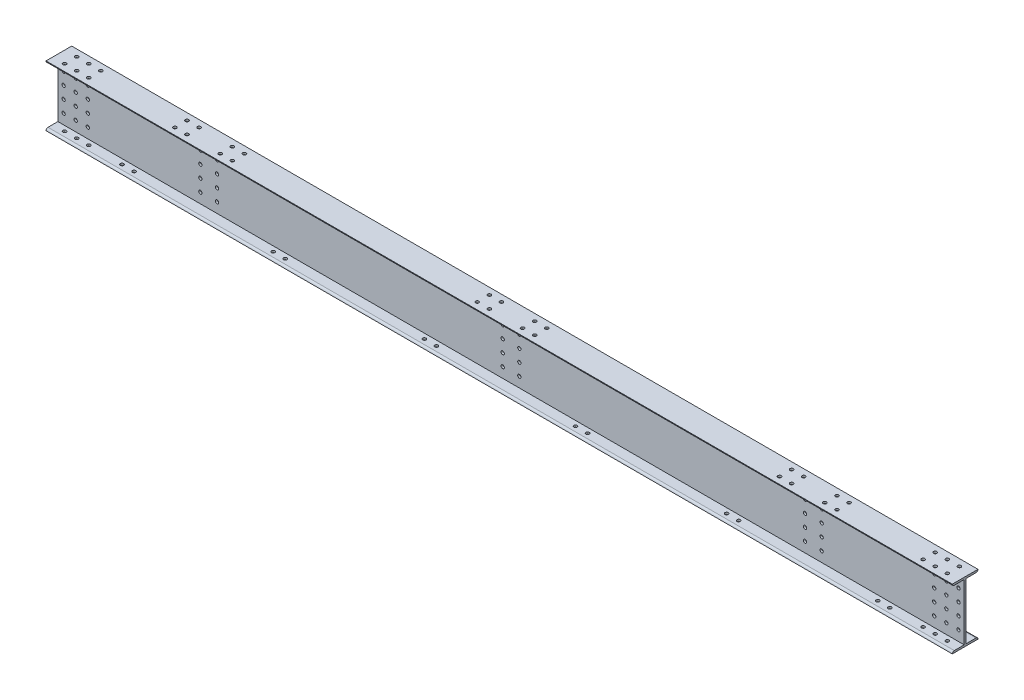
from build123d import *

# Parameters (mm, degrees)
SKETCH_1_W                         = 5996
SKETCH_1_H                         = 400
EXTRUDE_1_DEPTH                    = 170
SKETCH_2_R                         = 11
CUT_EXTRUDE_2_DEPTH                = 6012.731530932
PATTERN_LINEAR_4_COUNT             = 4
PATTERN_LINEAR_4_PITCH             = 80
PATTERN_LINEAR_5_COUNT             = 2
PATTERN_LINEAR_5_PITCH             = 80
PATTERN_LINEAR_5_COPY_1_SKETCH_R   = 11
PATTERN_LINEAR_5_COPY_1_DEPTH      = 6012.731530932
PATTERN_LINEAR_5_COPY_2_SKETCH_R   = 11
PATTERN_LINEAR_5_COPY_2_DEPTH      = 6012.731530932
PATTERN_LINEAR_5_COPY_3_SKETCH_R   = 11
PATTERN_LINEAR_5_COPY_3_DEPTH      = 6012.731530932
PATTERN_LINEAR_6_COUNT             = 2
PATTERN_LINEAR_6_PITCH             = 160
PATTERN_LINEAR_6_COPY_1_SKETCH_R   = 11
PATTERN_LINEAR_6_COPY_1_DEPTH      = 6012.731530932
PATTERN_LINEAR_6_COPY_2_SKETCH_R   = 11
PATTERN_LINEAR_6_COPY_2_DEPTH      = 6012.731530932
PATTERN_LINEAR_6_COPY_3_SKETCH_R   = 11
PATTERN_LINEAR_6_COPY_3_DEPTH      = 6012.731530932
PATTERN_LINEAR_7_COUNT             = 2
PATTERN_LINEAR_7_PITCH             = 905
PATTERN_LINEAR_7_COPY_1_SKETCH_R   = 11
PATTERN_LINEAR_7_COPY_1_DEPTH      = 6012.731530932
PATTERN_LINEAR_7_COPY_2_SKETCH_R   = 11
PATTERN_LINEAR_7_COPY_2_DEPTH      = 6012.731530932
PATTERN_LINEAR_7_COPY_3_SKETCH_R   = 11
PATTERN_LINEAR_7_COPY_3_DEPTH      = 6012.731530932
PATTERN_LINEAR_8_COUNT             = 2
PATTERN_LINEAR_8_PITCH             = 2905
PATTERN_LINEAR_8_COPY_1_SKETCH_R   = 11
PATTERN_LINEAR_8_COPY_1_DEPTH      = 6012.731530932
PATTERN_LINEAR_8_COPY_2_SKETCH_R   = 11
PATTERN_LINEAR_8_COPY_2_DEPTH      = 6012.731530932
PATTERN_LINEAR_8_COPY_3_SKETCH_R   = 11
PATTERN_LINEAR_8_COPY_3_DEPTH      = 6012.731530932
PATTERN_LINEAR_9_COUNT             = 2
PATTERN_LINEAR_9_PITCH             = 4905
PATTERN_LINEAR_9_COPY_1_SKETCH_R   = 11
PATTERN_LINEAR_9_COPY_1_DEPTH      = 6012.731530932
PATTERN_LINEAR_9_COPY_2_SKETCH_R   = 11
PATTERN_LINEAR_9_COPY_2_DEPTH      = 6012.731530932
PATTERN_LINEAR_9_COPY_3_SKETCH_R   = 11
PATTERN_LINEAR_9_COPY_3_DEPTH      = 6012.731530932
PATTERN_LINEAR_10_COUNT            = 2
PATTERN_LINEAR_10_PITCH            = 5760
PATTERN_LINEAR_10_COPY_1_SKETCH_R  = 11
PATTERN_LINEAR_10_COPY_1_DEPTH     = 6012.731530932
PATTERN_LINEAR_10_COPY_2_SKETCH_R  = 11
PATTERN_LINEAR_10_COPY_2_DEPTH     = 6012.731530932
PATTERN_LINEAR_10_COPY_3_SKETCH_R  = 11
PATTERN_LINEAR_10_COPY_3_DEPTH     = 6012.731530932
PATTERN_LINEAR_10_COPY_4_SKETCH_R  = 11
PATTERN_LINEAR_10_COPY_4_DEPTH     = 6012.731530932
PATTERN_LINEAR_10_COPY_5_SKETCH_R  = 11
PATTERN_LINEAR_10_COPY_5_DEPTH     = 6012.731530932
PATTERN_LINEAR_10_COPY_6_SKETCH_R  = 11
PATTERN_LINEAR_10_COPY_6_DEPTH     = 6012.731530932
PATTERN_LINEAR_10_COPY_7_SKETCH_R  = 11
PATTERN_LINEAR_10_COPY_7_DEPTH     = 6012.731530932
PATTERN_LINEAR_10_COPY_8_SKETCH_R  = 11
PATTERN_LINEAR_10_COPY_8_DEPTH     = 6012.731530932
PATTERN_LINEAR_10_COPY_9_SKETCH_R  = 11
PATTERN_LINEAR_10_COPY_9_DEPTH     = 6012.731530932
PATTERN_LINEAR_10_COPY_10_SKETCH_R = 11
PATTERN_LINEAR_10_COPY_10_DEPTH    = 6012.731530932
PATTERN_LINEAR_10_COPY_11_SKETCH_R = 11
PATTERN_LINEAR_10_COPY_11_DEPTH    = 6012.731530932
PATTERN_LINEAR_37_COUNT            = 2
PATTERN_LINEAR_37_PITCH            = 3015
PATTERN_LINEAR_37_COPY_1_SKETCH_R  = 11
PATTERN_LINEAR_37_COPY_1_DEPTH     = 6012.731530932
PATTERN_LINEAR_37_COPY_2_SKETCH_R  = 11
PATTERN_LINEAR_37_COPY_2_DEPTH     = 6012.731530932
PATTERN_LINEAR_37_COPY_3_SKETCH_R  = 11
PATTERN_LINEAR_37_COPY_3_DEPTH     = 6012.731530932
PATTERN_LINEAR_40_COUNT            = 2
PATTERN_LINEAR_40_PITCH            = 1015
PATTERN_LINEAR_40_COPY_1_SKETCH_R  = 11
PATTERN_LINEAR_40_COPY_1_DEPTH     = 6012.731530932
PATTERN_LINEAR_40_COPY_2_SKETCH_R  = 11
PATTERN_LINEAR_40_COPY_2_DEPTH     = 6012.731530932
PATTERN_LINEAR_40_COPY_3_SKETCH_R  = 11
PATTERN_LINEAR_40_COPY_3_DEPTH     = 6012.731530932
PATTERN_LINEAR_41_COUNT            = 2
PATTERN_LINEAR_41_PITCH            = 5015
PATTERN_LINEAR_41_COPY_1_SKETCH_R  = 11
PATTERN_LINEAR_41_COPY_1_DEPTH     = 6012.731530932
PATTERN_LINEAR_41_COPY_2_SKETCH_R  = 11
PATTERN_LINEAR_41_COPY_2_DEPTH     = 6012.731530932
PATTERN_LINEAR_41_COPY_3_SKETCH_R  = 11
PATTERN_LINEAR_41_COPY_3_DEPTH     = 6012.731530932
SKETCH_3_R                         = 11
CUT_EXTRUDE_3_DEPTH                = 120
PATTERN_LINEAR_11_COUNT            = 2
PATTERN_LINEAR_11_PITCH            = 80
PATTERN_LINEAR_12_COUNT            = 2
PATTERN_LINEAR_12_PITCH            = 80
PATTERN_LINEAR_12_COPY_1_SKETCH_R  = 11
PATTERN_LINEAR_12_COPY_1_DEPTH     = 120
PATTERN_LINEAR_13_COUNT            = 2
PATTERN_LINEAR_13_PITCH            = 160
PATTERN_LINEAR_13_COPY_1_SKETCH_R  = 11
PATTERN_LINEAR_13_COPY_1_DEPTH     = 120
PATTERN_LINEAR_14_COUNT            = 2
PATTERN_LINEAR_14_PITCH            = 730
PATTERN_LINEAR_14_COPY_1_SKETCH_R  = 11
PATTERN_LINEAR_14_COPY_1_DEPTH     = 120
PATTERN_LINEAR_14_COPY_2_SKETCH_R  = 11
PATTERN_LINEAR_14_COPY_2_DEPTH     = 120
PATTERN_LINEAR_14_COPY_3_SKETCH_R  = 11
PATTERN_LINEAR_14_COPY_3_DEPTH     = 120
PATTERN_LINEAR_16_COUNT            = 2
PATTERN_LINEAR_16_PITCH            = 1030
PATTERN_LINEAR_16_COPY_1_SKETCH_R  = 11
PATTERN_LINEAR_16_COPY_1_DEPTH     = 120
PATTERN_LINEAR_16_COPY_2_SKETCH_R  = 11
PATTERN_LINEAR_16_COPY_2_DEPTH     = 120
PATTERN_LINEAR_16_COPY_3_SKETCH_R  = 11
PATTERN_LINEAR_16_COPY_3_DEPTH     = 120
PATTERN_LINEAR_17_COUNT            = 2
PATTERN_LINEAR_17_PITCH            = 2730
PATTERN_LINEAR_17_COPY_1_SKETCH_R  = 11
PATTERN_LINEAR_17_COPY_1_DEPTH     = 120
PATTERN_LINEAR_17_COPY_2_SKETCH_R  = 11
PATTERN_LINEAR_17_COPY_2_DEPTH     = 120
PATTERN_LINEAR_17_COPY_3_SKETCH_R  = 11
PATTERN_LINEAR_17_COPY_3_DEPTH     = 120
PATTERN_LINEAR_19_COUNT            = 2
PATTERN_LINEAR_19_PITCH            = 3030
PATTERN_LINEAR_19_COPY_1_SKETCH_R  = 11
PATTERN_LINEAR_19_COPY_1_DEPTH     = 120
PATTERN_LINEAR_19_COPY_2_SKETCH_R  = 11
PATTERN_LINEAR_19_COPY_2_DEPTH     = 120
PATTERN_LINEAR_19_COPY_3_SKETCH_R  = 11
PATTERN_LINEAR_19_COPY_3_DEPTH     = 120
PATTERN_LINEAR_20_COUNT            = 2
PATTERN_LINEAR_20_PITCH            = 4730
PATTERN_LINEAR_20_COPY_1_SKETCH_R  = 11
PATTERN_LINEAR_20_COPY_1_DEPTH     = 120
PATTERN_LINEAR_20_COPY_2_SKETCH_R  = 11
PATTERN_LINEAR_20_COPY_2_DEPTH     = 120
PATTERN_LINEAR_20_COPY_3_SKETCH_R  = 11
PATTERN_LINEAR_20_COPY_3_DEPTH     = 120
PATTERN_LINEAR_22_COUNT            = 2
PATTERN_LINEAR_22_PITCH            = 5030
PATTERN_LINEAR_22_COPY_1_SKETCH_R  = 11
PATTERN_LINEAR_22_COPY_1_DEPTH     = 120
PATTERN_LINEAR_22_COPY_2_SKETCH_R  = 11
PATTERN_LINEAR_22_COPY_2_DEPTH     = 120
PATTERN_LINEAR_22_COPY_3_SKETCH_R  = 11
PATTERN_LINEAR_22_COPY_3_DEPTH     = 120
PATTERN_LINEAR_23_COUNT            = 2
PATTERN_LINEAR_23_PITCH            = 5680
PATTERN_LINEAR_23_COPY_1_SKETCH_R  = 11
PATTERN_LINEAR_23_COPY_1_DEPTH     = 120
PATTERN_LINEAR_23_COPY_2_SKETCH_R  = 11
PATTERN_LINEAR_23_COPY_2_DEPTH     = 120
PATTERN_LINEAR_23_COPY_3_SKETCH_R  = 11
PATTERN_LINEAR_23_COPY_3_DEPTH     = 120
PATTERN_LINEAR_23_COPY_4_SKETCH_R  = 11
PATTERN_LINEAR_23_COPY_4_DEPTH     = 120
PATTERN_LINEAR_23_COPY_5_SKETCH_R  = 11
PATTERN_LINEAR_23_COPY_5_DEPTH     = 120
CUT_EXTRUDE_START                  = -120
SKETCH_4_R                         = 11
CUT_EXTRUDE_4_DEPTH                = 120
PATTERN_LINEAR_24_COUNT            = 2
PATTERN_LINEAR_24_PITCH            = 80
PATTERN_LINEAR_25_COUNT            = 2
PATTERN_LINEAR_25_PITCH            = 80
PATTERN_START                      = -120
PATTERN_LINEAR_25_COPY_1_SKETCH_R  = 11
PATTERN_LINEAR_25_COPY_1_DEPTH     = 120
PATTERN_LINEAR_26_COUNT            = 2
PATTERN_LINEAR_26_PITCH            = 160
PATTERN_LINEAR_26_COPY_1_SKETCH_R  = 11
PATTERN_LINEAR_26_COPY_1_DEPTH     = 120
PATTERN_LINEAR_27_COUNT            = 2
PATTERN_LINEAR_27_PITCH            = 380
PATTERN_LINEAR_27_COPY_1_SKETCH_R  = 11
PATTERN_LINEAR_27_COPY_1_DEPTH     = 120
PATTERN_LINEAR_27_COPY_2_SKETCH_R  = 11
PATTERN_LINEAR_27_COPY_2_DEPTH     = 120
PATTERN_LINEAR_27_COPY_3_SKETCH_R  = 11
PATTERN_LINEAR_27_COPY_3_DEPTH     = 120
PATTERN_LINEAR_28_COUNT            = 2
PATTERN_LINEAR_28_PITCH            = 1380
PATTERN_LINEAR_28_COPY_1_SKETCH_R  = 11
PATTERN_LINEAR_28_COPY_1_DEPTH     = 120
PATTERN_LINEAR_28_COPY_2_SKETCH_R  = 11
PATTERN_LINEAR_28_COPY_2_DEPTH     = 120
PATTERN_LINEAR_28_COPY_3_SKETCH_R  = 11
PATTERN_LINEAR_28_COPY_3_DEPTH     = 120
PATTERN_LINEAR_29_COUNT            = 2
PATTERN_LINEAR_29_PITCH            = 2380
PATTERN_LINEAR_29_COPY_1_SKETCH_R  = 11
PATTERN_LINEAR_29_COPY_1_DEPTH     = 120
PATTERN_LINEAR_29_COPY_2_SKETCH_R  = 11
PATTERN_LINEAR_29_COPY_2_DEPTH     = 120
PATTERN_LINEAR_29_COPY_3_SKETCH_R  = 11
PATTERN_LINEAR_29_COPY_3_DEPTH     = 120
PATTERN_LINEAR_30_COUNT            = 2
PATTERN_LINEAR_30_PITCH            = 3380
PATTERN_LINEAR_30_COPY_1_SKETCH_R  = 11
PATTERN_LINEAR_30_COPY_1_DEPTH     = 120
PATTERN_LINEAR_30_COPY_2_SKETCH_R  = 11
PATTERN_LINEAR_30_COPY_2_DEPTH     = 120
PATTERN_LINEAR_30_COPY_3_SKETCH_R  = 11
PATTERN_LINEAR_30_COPY_3_DEPTH     = 120
PATTERN_LINEAR_31_COUNT            = 2
PATTERN_LINEAR_31_PITCH            = 4380
PATTERN_LINEAR_31_COPY_1_SKETCH_R  = 11
PATTERN_LINEAR_31_COPY_1_DEPTH     = 120
PATTERN_LINEAR_31_COPY_2_SKETCH_R  = 11
PATTERN_LINEAR_31_COPY_2_DEPTH     = 120
PATTERN_LINEAR_31_COPY_3_SKETCH_R  = 11
PATTERN_LINEAR_31_COPY_3_DEPTH     = 120
PATTERN_LINEAR_32_COUNT            = 2
PATTERN_LINEAR_32_PITCH            = 5380
PATTERN_LINEAR_32_COPY_1_SKETCH_R  = 11
PATTERN_LINEAR_32_COPY_1_DEPTH     = 120
PATTERN_LINEAR_32_COPY_2_SKETCH_R  = 11
PATTERN_LINEAR_32_COPY_2_DEPTH     = 120
PATTERN_LINEAR_32_COPY_3_SKETCH_R  = 11
PATTERN_LINEAR_32_COPY_3_DEPTH     = 120
PATTERN_LINEAR_33_COUNT            = 2
PATTERN_LINEAR_33_PITCH            = 5680
PATTERN_LINEAR_33_COPY_1_SKETCH_R  = 11
PATTERN_LINEAR_33_COPY_1_DEPTH     = 120
PATTERN_LINEAR_33_COPY_2_SKETCH_R  = 11
PATTERN_LINEAR_33_COPY_2_DEPTH     = 120
PATTERN_LINEAR_33_COPY_3_SKETCH_R  = 11
PATTERN_LINEAR_33_COPY_3_DEPTH     = 120
PATTERN_LINEAR_33_COPY_4_SKETCH_R  = 11
PATTERN_LINEAR_33_COPY_4_DEPTH     = 120
PATTERN_LINEAR_33_COPY_5_SKETCH_R  = 11
PATTERN_LINEAR_33_COPY_5_DEPTH     = 120
SKETCH_6_W                         = 78.5
SKETCH_6_H                         = 374
CUT_EXTRUDE_5_DEPTH                = 6012.731530932
FILLET_1_R                         = 13
FILLET_2_R                         = 13
FILLET_3_R                         = 13
FILLET_4_R                         = 13


with BuildPart() as part:
    # 草图1 → 拉伸1 (new body)
    with BuildSketch(Plane.XY):
        with Locations((2998, 200)):
            Rectangle(SKETCH_1_W, SKETCH_1_H)
    extrude(amount=EXTRUDE_1_DEPTH)

    # 草图2 → 切除-拉伸2 (cut, through all)
    with BuildSketch(Plane.XY.offset(170)):
        with Locations((38, 80)):
            Circle(SKETCH_2_R)
    cut_extrude_2 = extrude(amount=-CUT_EXTRUDE_2_DEPTH, mode=Mode.SUBTRACT)

    # 阵列(线性)4: 切除-拉伸2 ×4
    with Locations(*[(0, i * PATTERN_LINEAR_4_PITCH, 0) for i in range(1, PATTERN_LINEAR_4_COUNT)]):
        add(cut_extrude_2, mode=Mode.SUBTRACT)

    # 阵列(线性)5: 切除-拉伸2 ×2
    with Locations(*[(i * PATTERN_LINEAR_5_PITCH, 0, 0) for i in range(1, PATTERN_LINEAR_5_COUNT)]):
        add(cut_extrude_2, mode=Mode.SUBTRACT)

    # 阵列(线性)5 copy 1 sketch → 阵列(线性)5 copy 1 (cut, through all)
    with BuildSketch(Plane(origin=(80, 80, 170), x_dir=(1, 0, 0), z_dir=(0, 0, 1))):
        with Locations((38, 80)):
            Circle(PATTERN_LINEAR_5_COPY_1_SKETCH_R)
    extrude(amount=-PATTERN_LINEAR_5_COPY_1_DEPTH, mode=Mode.SUBTRACT)

    # 阵列(线性)5 copy 2 sketch → 阵列(线性)5 copy 2 (cut, through all)
    with BuildSketch(Plane(origin=(80, 160, 170), x_dir=(1, 0, 0), z_dir=(0, 0, 1))):
        with Locations((38, 80)):
            Circle(PATTERN_LINEAR_5_COPY_2_SKETCH_R)
    extrude(amount=-PATTERN_LINEAR_5_COPY_2_DEPTH, mode=Mode.SUBTRACT)

    # 阵列(线性)5 copy 3 sketch → 阵列(线性)5 copy 3 (cut, through all)
    with BuildSketch(Plane(origin=(80, 240, 170), x_dir=(1, 0, 0), z_dir=(0, 0, 1))):
        with Locations((38, 80)):
            Circle(PATTERN_LINEAR_5_COPY_3_SKETCH_R)
    extrude(amount=-PATTERN_LINEAR_5_COPY_3_DEPTH, mode=Mode.SUBTRACT)

    # 阵列(线性)6: 切除-拉伸2 ×2
    with Locations(*[(i * PATTERN_LINEAR_6_PITCH, 0, 0) for i in range(1, PATTERN_LINEAR_6_COUNT)]):
        add(cut_extrude_2, mode=Mode.SUBTRACT)

    # 阵列(线性)6 copy 1 sketch → 阵列(线性)6 copy 1 (cut, through all)
    with BuildSketch(Plane(origin=(160, 80, 170), x_dir=(1, 0, 0), z_dir=(0, 0, 1))):
        with Locations((38, 80)):
            Circle(PATTERN_LINEAR_6_COPY_1_SKETCH_R)
    extrude(amount=-PATTERN_LINEAR_6_COPY_1_DEPTH, mode=Mode.SUBTRACT)

    # 阵列(线性)6 copy 2 sketch → 阵列(线性)6 copy 2 (cut, through all)
    with BuildSketch(Plane(origin=(160, 160, 170), x_dir=(1, 0, 0), z_dir=(0, 0, 1))):
        with Locations((38, 80)):
            Circle(PATTERN_LINEAR_6_COPY_2_SKETCH_R)
    extrude(amount=-PATTERN_LINEAR_6_COPY_2_DEPTH, mode=Mode.SUBTRACT)

    # 阵列(线性)6 copy 3 sketch → 阵列(线性)6 copy 3 (cut, through all)
    with BuildSketch(Plane(origin=(160, 240, 170), x_dir=(1, 0, 0), z_dir=(0, 0, 1))):
        with Locations((38, 80)):
            Circle(PATTERN_LINEAR_6_COPY_3_SKETCH_R)
    extrude(amount=-PATTERN_LINEAR_6_COPY_3_DEPTH, mode=Mode.SUBTRACT)

    # 阵列(线性)7: 切除-拉伸2 ×2
    with Locations(*[(i * PATTERN_LINEAR_7_PITCH, 0, 0) for i in range(1, PATTERN_LINEAR_7_COUNT)]):
        add(cut_extrude_2, mode=Mode.SUBTRACT)

    # 阵列(线性)7 copy 1 sketch → 阵列(线性)7 copy 1 (cut, through all)
    with BuildSketch(Plane(origin=(905, 80, 170), x_dir=(1, 0, 0), z_dir=(0, 0, 1))):
        with Locations((38, 80)):
            Circle(PATTERN_LINEAR_7_COPY_1_SKETCH_R)
    extrude(amount=-PATTERN_LINEAR_7_COPY_1_DEPTH, mode=Mode.SUBTRACT)

    # 阵列(线性)7 copy 2 sketch → 阵列(线性)7 copy 2 (cut, through all)
    with BuildSketch(Plane(origin=(905, 160, 170), x_dir=(1, 0, 0), z_dir=(0, 0, 1))):
        with Locations((38, 80)):
            Circle(PATTERN_LINEAR_7_COPY_2_SKETCH_R)
    extrude(amount=-PATTERN_LINEAR_7_COPY_2_DEPTH, mode=Mode.SUBTRACT)

    # 阵列(线性)7 copy 3 sketch → 阵列(线性)7 copy 3 (cut, through all)
    with BuildSketch(Plane(origin=(905, 240, 170), x_dir=(1, 0, 0), z_dir=(0, 0, 1))):
        with Locations((38, 80)):
            Circle(PATTERN_LINEAR_7_COPY_3_SKETCH_R)
    extrude(amount=-PATTERN_LINEAR_7_COPY_3_DEPTH, mode=Mode.SUBTRACT)

    # 阵列(线性)8: 切除-拉伸2 ×2
    with Locations(*[(i * PATTERN_LINEAR_8_PITCH, 0, 0) for i in range(1, PATTERN_LINEAR_8_COUNT)]):
        add(cut_extrude_2, mode=Mode.SUBTRACT)

    # 阵列(线性)8 copy 1 sketch → 阵列(线性)8 copy 1 (cut, through all)
    with BuildSketch(Plane(origin=(2905, 80, 170), x_dir=(1, 0, 0), z_dir=(0, 0, 1))):
        with Locations((38, 80)):
            Circle(PATTERN_LINEAR_8_COPY_1_SKETCH_R)
    extrude(amount=-PATTERN_LINEAR_8_COPY_1_DEPTH, mode=Mode.SUBTRACT)

    # 阵列(线性)8 copy 2 sketch → 阵列(线性)8 copy 2 (cut, through all)
    with BuildSketch(Plane(origin=(2905, 160, 170), x_dir=(1, 0, 0), z_dir=(0, 0, 1))):
        with Locations((38, 80)):
            Circle(PATTERN_LINEAR_8_COPY_2_SKETCH_R)
    extrude(amount=-PATTERN_LINEAR_8_COPY_2_DEPTH, mode=Mode.SUBTRACT)

    # 阵列(线性)8 copy 3 sketch → 阵列(线性)8 copy 3 (cut, through all)
    with BuildSketch(Plane(origin=(2905, 240, 170), x_dir=(1, 0, 0), z_dir=(0, 0, 1))):
        with Locations((38, 80)):
            Circle(PATTERN_LINEAR_8_COPY_3_SKETCH_R)
    extrude(amount=-PATTERN_LINEAR_8_COPY_3_DEPTH, mode=Mode.SUBTRACT)

    # 阵列(线性)9: 切除-拉伸2 ×2
    with Locations(*[(i * PATTERN_LINEAR_9_PITCH, 0, 0) for i in range(1, PATTERN_LINEAR_9_COUNT)]):
        add(cut_extrude_2, mode=Mode.SUBTRACT)

    # 阵列(线性)9 copy 1 sketch → 阵列(线性)9 copy 1 (cut, through all)
    with BuildSketch(Plane(origin=(4905, 80, 170), x_dir=(1, 0, 0), z_dir=(0, 0, 1))):
        with Locations((38, 80)):
            Circle(PATTERN_LINEAR_9_COPY_1_SKETCH_R)
    extrude(amount=-PATTERN_LINEAR_9_COPY_1_DEPTH, mode=Mode.SUBTRACT)

    # 阵列(线性)9 copy 2 sketch → 阵列(线性)9 copy 2 (cut, through all)
    with BuildSketch(Plane(origin=(4905, 160, 170), x_dir=(1, 0, 0), z_dir=(0, 0, 1))):
        with Locations((38, 80)):
            Circle(PATTERN_LINEAR_9_COPY_2_SKETCH_R)
    extrude(amount=-PATTERN_LINEAR_9_COPY_2_DEPTH, mode=Mode.SUBTRACT)

    # 阵列(线性)9 copy 3 sketch → 阵列(线性)9 copy 3 (cut, through all)
    with BuildSketch(Plane(origin=(4905, 240, 170), x_dir=(1, 0, 0), z_dir=(0, 0, 1))):
        with Locations((38, 80)):
            Circle(PATTERN_LINEAR_9_COPY_3_SKETCH_R)
    extrude(amount=-PATTERN_LINEAR_9_COPY_3_DEPTH, mode=Mode.SUBTRACT)

    # 阵列(线性)10: 切除-拉伸2 ×2
    with Locations(*[(i * PATTERN_LINEAR_10_PITCH, 0, 0) for i in range(1, PATTERN_LINEAR_10_COUNT)]):
        add(cut_extrude_2, mode=Mode.SUBTRACT)

    # 阵列(线性)10 copy 1 sketch → 阵列(线性)10 copy 1 (cut, through all)
    with BuildSketch(Plane(origin=(5760, 80, 170), x_dir=(1, 0, 0), z_dir=(0, 0, 1))):
        with Locations((38, 80)):
            Circle(PATTERN_LINEAR_10_COPY_1_SKETCH_R)
    extrude(amount=-PATTERN_LINEAR_10_COPY_1_DEPTH, mode=Mode.SUBTRACT)

    # 阵列(线性)10 copy 2 sketch → 阵列(线性)10 copy 2 (cut, through all)
    with BuildSketch(Plane(origin=(5760, 160, 170), x_dir=(1, 0, 0), z_dir=(0, 0, 1))):
        with Locations((38, 80)):
            Circle(PATTERN_LINEAR_10_COPY_2_SKETCH_R)
    extrude(amount=-PATTERN_LINEAR_10_COPY_2_DEPTH, mode=Mode.SUBTRACT)

    # 阵列(线性)10 copy 3 sketch → 阵列(线性)10 copy 3 (cut, through all)
    with BuildSketch(Plane(origin=(5760, 240, 170), x_dir=(1, 0, 0), z_dir=(0, 0, 1))):
        with Locations((38, 80)):
            Circle(PATTERN_LINEAR_10_COPY_3_SKETCH_R)
    extrude(amount=-PATTERN_LINEAR_10_COPY_3_DEPTH, mode=Mode.SUBTRACT)

    # 阵列(线性)10 copy 4 sketch → 阵列(线性)10 copy 4 (cut, through all)
    with BuildSketch(Plane(origin=(5840, 0, 170), x_dir=(1, 0, 0), z_dir=(0, 0, 1))):
        with Locations((38, 80)):
            Circle(PATTERN_LINEAR_10_COPY_4_SKETCH_R)
    extrude(amount=-PATTERN_LINEAR_10_COPY_4_DEPTH, mode=Mode.SUBTRACT)

    # 阵列(线性)10 copy 5 sketch → 阵列(线性)10 copy 5 (cut, through all)
    with BuildSketch(Plane(origin=(5840, 80, 170), x_dir=(1, 0, 0), z_dir=(0, 0, 1))):
        with Locations((38, 80)):
            Circle(PATTERN_LINEAR_10_COPY_5_SKETCH_R)
    extrude(amount=-PATTERN_LINEAR_10_COPY_5_DEPTH, mode=Mode.SUBTRACT)

    # 阵列(线性)10 copy 6 sketch → 阵列(线性)10 copy 6 (cut, through all)
    with BuildSketch(Plane(origin=(5840, 160, 170), x_dir=(1, 0, 0), z_dir=(0, 0, 1))):
        with Locations((38, 80)):
            Circle(PATTERN_LINEAR_10_COPY_6_SKETCH_R)
    extrude(amount=-PATTERN_LINEAR_10_COPY_6_DEPTH, mode=Mode.SUBTRACT)

    # 阵列(线性)10 copy 7 sketch → 阵列(线性)10 copy 7 (cut, through all)
    with BuildSketch(Plane(origin=(5840, 240, 170), x_dir=(1, 0, 0), z_dir=(0, 0, 1))):
        with Locations((38, 80)):
            Circle(PATTERN_LINEAR_10_COPY_7_SKETCH_R)
    extrude(amount=-PATTERN_LINEAR_10_COPY_7_DEPTH, mode=Mode.SUBTRACT)

    # 阵列(线性)10 copy 8 sketch → 阵列(线性)10 copy 8 (cut, through all)
    with BuildSketch(Plane(origin=(5920, 0, 170), x_dir=(1, 0, 0), z_dir=(0, 0, 1))):
        with Locations((38, 80)):
            Circle(PATTERN_LINEAR_10_COPY_8_SKETCH_R)
    extrude(amount=-PATTERN_LINEAR_10_COPY_8_DEPTH, mode=Mode.SUBTRACT)

    # 阵列(线性)10 copy 9 sketch → 阵列(线性)10 copy 9 (cut, through all)
    with BuildSketch(Plane(origin=(5920, 80, 170), x_dir=(1, 0, 0), z_dir=(0, 0, 1))):
        with Locations((38, 80)):
            Circle(PATTERN_LINEAR_10_COPY_9_SKETCH_R)
    extrude(amount=-PATTERN_LINEAR_10_COPY_9_DEPTH, mode=Mode.SUBTRACT)

    # 阵列(线性)10 copy 10 sketch → 阵列(线性)10 copy 10 (cut, through all)
    with BuildSketch(Plane(origin=(5920, 160, 170), x_dir=(1, 0, 0), z_dir=(0, 0, 1))):
        with Locations((38, 80)):
            Circle(PATTERN_LINEAR_10_COPY_10_SKETCH_R)
    extrude(amount=-PATTERN_LINEAR_10_COPY_10_DEPTH, mode=Mode.SUBTRACT)

    # 阵列(线性)10 copy 11 sketch → 阵列(线性)10 copy 11 (cut, through all)
    with BuildSketch(Plane(origin=(5920, 240, 170), x_dir=(1, 0, 0), z_dir=(0, 0, 1))):
        with Locations((38, 80)):
            Circle(PATTERN_LINEAR_10_COPY_11_SKETCH_R)
    extrude(amount=-PATTERN_LINEAR_10_COPY_11_DEPTH, mode=Mode.SUBTRACT)

    # 阵列(线性)37: 切除-拉伸2 ×2
    with Locations(*[(i * PATTERN_LINEAR_37_PITCH, 0, 0) for i in range(1, PATTERN_LINEAR_37_COUNT)]):
        add(cut_extrude_2, mode=Mode.SUBTRACT)

    # 阵列(线性)37 copy 1 sketch → 阵列(线性)37 copy 1 (cut, through all)
    with BuildSketch(Plane(origin=(3015, 80, 170), x_dir=(1, 0, 0), z_dir=(0, 0, 1))):
        with Locations((38, 80)):
            Circle(PATTERN_LINEAR_37_COPY_1_SKETCH_R)
    extrude(amount=-PATTERN_LINEAR_37_COPY_1_DEPTH, mode=Mode.SUBTRACT)

    # 阵列(线性)37 copy 2 sketch → 阵列(线性)37 copy 2 (cut, through all)
    with BuildSketch(Plane(origin=(3015, 160, 170), x_dir=(1, 0, 0), z_dir=(0, 0, 1))):
        with Locations((38, 80)):
            Circle(PATTERN_LINEAR_37_COPY_2_SKETCH_R)
    extrude(amount=-PATTERN_LINEAR_37_COPY_2_DEPTH, mode=Mode.SUBTRACT)

    # 阵列(线性)37 copy 3 sketch → 阵列(线性)37 copy 3 (cut, through all)
    with BuildSketch(Plane(origin=(3015, 240, 170), x_dir=(1, 0, 0), z_dir=(0, 0, 1))):
        with Locations((38, 80)):
            Circle(PATTERN_LINEAR_37_COPY_3_SKETCH_R)
    extrude(amount=-PATTERN_LINEAR_37_COPY_3_DEPTH, mode=Mode.SUBTRACT)

    # 阵列(线性)40: 切除-拉伸2 ×2
    with Locations(*[(i * PATTERN_LINEAR_40_PITCH, 0, 0) for i in range(1, PATTERN_LINEAR_40_COUNT)]):
        add(cut_extrude_2, mode=Mode.SUBTRACT)

    # 阵列(线性)40 copy 1 sketch → 阵列(线性)40 copy 1 (cut, through all)
    with BuildSketch(Plane(origin=(1015, 80, 170), x_dir=(1, 0, 0), z_dir=(0, 0, 1))):
        with Locations((38, 80)):
            Circle(PATTERN_LINEAR_40_COPY_1_SKETCH_R)
    extrude(amount=-PATTERN_LINEAR_40_COPY_1_DEPTH, mode=Mode.SUBTRACT)

    # 阵列(线性)40 copy 2 sketch → 阵列(线性)40 copy 2 (cut, through all)
    with BuildSketch(Plane(origin=(1015, 160, 170), x_dir=(1, 0, 0), z_dir=(0, 0, 1))):
        with Locations((38, 80)):
            Circle(PATTERN_LINEAR_40_COPY_2_SKETCH_R)
    extrude(amount=-PATTERN_LINEAR_40_COPY_2_DEPTH, mode=Mode.SUBTRACT)

    # 阵列(线性)40 copy 3 sketch → 阵列(线性)40 copy 3 (cut, through all)
    with BuildSketch(Plane(origin=(1015, 240, 170), x_dir=(1, 0, 0), z_dir=(0, 0, 1))):
        with Locations((38, 80)):
            Circle(PATTERN_LINEAR_40_COPY_3_SKETCH_R)
    extrude(amount=-PATTERN_LINEAR_40_COPY_3_DEPTH, mode=Mode.SUBTRACT)

    # 阵列(线性)41: 切除-拉伸2 ×2
    with Locations(*[(i * PATTERN_LINEAR_41_PITCH, 0, 0) for i in range(1, PATTERN_LINEAR_41_COUNT)]):
        add(cut_extrude_2, mode=Mode.SUBTRACT)

    # 阵列(线性)41 copy 1 sketch → 阵列(线性)41 copy 1 (cut, through all)
    with BuildSketch(Plane(origin=(5015, 80, 170), x_dir=(1, 0, 0), z_dir=(0, 0, 1))):
        with Locations((38, 80)):
            Circle(PATTERN_LINEAR_41_COPY_1_SKETCH_R)
    extrude(amount=-PATTERN_LINEAR_41_COPY_1_DEPTH, mode=Mode.SUBTRACT)

    # 阵列(线性)41 copy 2 sketch → 阵列(线性)41 copy 2 (cut, through all)
    with BuildSketch(Plane(origin=(5015, 160, 170), x_dir=(1, 0, 0), z_dir=(0, 0, 1))):
        with Locations((38, 80)):
            Circle(PATTERN_LINEAR_41_COPY_2_SKETCH_R)
    extrude(amount=-PATTERN_LINEAR_41_COPY_2_DEPTH, mode=Mode.SUBTRACT)

    # 阵列(线性)41 copy 3 sketch → 阵列(线性)41 copy 3 (cut, through all)
    with BuildSketch(Plane(origin=(5015, 240, 170), x_dir=(1, 0, 0), z_dir=(0, 0, 1))):
        with Locations((38, 80)):
            Circle(PATTERN_LINEAR_41_COPY_3_SKETCH_R)
    extrude(amount=-PATTERN_LINEAR_41_COPY_3_DEPTH, mode=Mode.SUBTRACT)

    # 草图3 → 切除-拉伸3 (cut)
    with BuildSketch(Plane(origin=(0, 400, 0), x_dir=(1, 0, 0), z_dir=(0, 1, 0))):
        with Locations(Location((78, -125, 0), (0, 0, 270))):
            Circle(SKETCH_3_R)
    cut_extrude_3 = extrude(amount=-CUT_EXTRUDE_3_DEPTH, mode=Mode.SUBTRACT)

    # 阵列(线性)11: 切除-拉伸3 ×2
    with Locations(*[(0, 0, -i * PATTERN_LINEAR_11_PITCH) for i in range(1, PATTERN_LINEAR_11_COUNT)]):
        add(cut_extrude_3, mode=Mode.SUBTRACT)

    # 阵列(线性)12: 切除-拉伸3 ×2
    with Locations(*[(i * PATTERN_LINEAR_12_PITCH, 0, 0) for i in range(1, PATTERN_LINEAR_12_COUNT)]):
        add(cut_extrude_3, mode=Mode.SUBTRACT)

    # 阵列(线性)12 copy 1 sketch → 阵列(线性)12 copy 1 (cut)
    with BuildSketch(Plane(origin=(80, 400, -80), x_dir=(1, 0, 0), z_dir=(0, 1, 0))):
        with Locations(Location((78, -125, 0), (0, 0, 270))):
            Circle(PATTERN_LINEAR_12_COPY_1_SKETCH_R)
    extrude(amount=-PATTERN_LINEAR_12_COPY_1_DEPTH, mode=Mode.SUBTRACT)

    # 阵列(线性)13: 切除-拉伸3 ×2
    with Locations(*[(i * PATTERN_LINEAR_13_PITCH, 0, 0) for i in range(1, PATTERN_LINEAR_13_COUNT)]):
        add(cut_extrude_3, mode=Mode.SUBTRACT)

    # 阵列(线性)13 copy 1 sketch → 阵列(线性)13 copy 1 (cut)
    with BuildSketch(Plane(origin=(160, 400, -80), x_dir=(1, 0, 0), z_dir=(0, 1, 0))):
        with Locations(Location((78, -125, 0), (0, 0, 270))):
            Circle(PATTERN_LINEAR_13_COPY_1_SKETCH_R)
    extrude(amount=-PATTERN_LINEAR_13_COPY_1_DEPTH, mode=Mode.SUBTRACT)

    # 阵列(线性)14: 切除-拉伸3 ×2
    with Locations(*[(i * PATTERN_LINEAR_14_PITCH, 0, 0) for i in range(1, PATTERN_LINEAR_14_COUNT)]):
        add(cut_extrude_3, mode=Mode.SUBTRACT)

    # 阵列(线性)14 copy 1 sketch → 阵列(线性)14 copy 1 (cut)
    with BuildSketch(Plane(origin=(730, 400, -80), x_dir=(1, 0, 0), z_dir=(0, 1, 0))):
        with Locations(Location((78, -125, 0), (0, 0, 270))):
            Circle(PATTERN_LINEAR_14_COPY_1_SKETCH_R)
    extrude(amount=-PATTERN_LINEAR_14_COPY_1_DEPTH, mode=Mode.SUBTRACT)

    # 阵列(线性)14 copy 2 sketch → 阵列(线性)14 copy 2 (cut)
    with BuildSketch(Plane(origin=(810, 400, 0), x_dir=(1, 0, 0), z_dir=(0, 1, 0))):
        with Locations(Location((78, -125, 0), (0, 0, 270))):
            Circle(PATTERN_LINEAR_14_COPY_2_SKETCH_R)
    extrude(amount=-PATTERN_LINEAR_14_COPY_2_DEPTH, mode=Mode.SUBTRACT)

    # 阵列(线性)14 copy 3 sketch → 阵列(线性)14 copy 3 (cut)
    with BuildSketch(Plane(origin=(810, 400, -80), x_dir=(1, 0, 0), z_dir=(0, 1, 0))):
        with Locations(Location((78, -125, 0), (0, 0, 270))):
            Circle(PATTERN_LINEAR_14_COPY_3_SKETCH_R)
    extrude(amount=-PATTERN_LINEAR_14_COPY_3_DEPTH, mode=Mode.SUBTRACT)

    # 阵列(线性)16: 切除-拉伸3 ×2
    with Locations(*[(i * PATTERN_LINEAR_16_PITCH, 0, 0) for i in range(1, PATTERN_LINEAR_16_COUNT)]):
        add(cut_extrude_3, mode=Mode.SUBTRACT)

    # 阵列(线性)16 copy 1 sketch → 阵列(线性)16 copy 1 (cut)
    with BuildSketch(Plane(origin=(1030, 400, -80), x_dir=(1, 0, 0), z_dir=(0, 1, 0))):
        with Locations(Location((78, -125, 0), (0, 0, 270))):
            Circle(PATTERN_LINEAR_16_COPY_1_SKETCH_R)
    extrude(amount=-PATTERN_LINEAR_16_COPY_1_DEPTH, mode=Mode.SUBTRACT)

    # 阵列(线性)16 copy 2 sketch → 阵列(线性)16 copy 2 (cut)
    with BuildSketch(Plane(origin=(1110, 400, 0), x_dir=(1, 0, 0), z_dir=(0, 1, 0))):
        with Locations(Location((78, -125, 0), (0, 0, 270))):
            Circle(PATTERN_LINEAR_16_COPY_2_SKETCH_R)
    extrude(amount=-PATTERN_LINEAR_16_COPY_2_DEPTH, mode=Mode.SUBTRACT)

    # 阵列(线性)16 copy 3 sketch → 阵列(线性)16 copy 3 (cut)
    with BuildSketch(Plane(origin=(1110, 400, -80), x_dir=(1, 0, 0), z_dir=(0, 1, 0))):
        with Locations(Location((78, -125, 0), (0, 0, 270))):
            Circle(PATTERN_LINEAR_16_COPY_3_SKETCH_R)
    extrude(amount=-PATTERN_LINEAR_16_COPY_3_DEPTH, mode=Mode.SUBTRACT)

    # 阵列(线性)17: 切除-拉伸3 ×2
    with Locations(*[(i * PATTERN_LINEAR_17_PITCH, 0, 0) for i in range(1, PATTERN_LINEAR_17_COUNT)]):
        add(cut_extrude_3, mode=Mode.SUBTRACT)

    # 阵列(线性)17 copy 1 sketch → 阵列(线性)17 copy 1 (cut)
    with BuildSketch(Plane(origin=(2730, 400, -80), x_dir=(1, 0, 0), z_dir=(0, 1, 0))):
        with Locations(Location((78, -125, 0), (0, 0, 270))):
            Circle(PATTERN_LINEAR_17_COPY_1_SKETCH_R)
    extrude(amount=-PATTERN_LINEAR_17_COPY_1_DEPTH, mode=Mode.SUBTRACT)

    # 阵列(线性)17 copy 2 sketch → 阵列(线性)17 copy 2 (cut)
    with BuildSketch(Plane(origin=(2810, 400, 0), x_dir=(1, 0, 0), z_dir=(0, 1, 0))):
        with Locations(Location((78, -125, 0), (0, 0, 270))):
            Circle(PATTERN_LINEAR_17_COPY_2_SKETCH_R)
    extrude(amount=-PATTERN_LINEAR_17_COPY_2_DEPTH, mode=Mode.SUBTRACT)

    # 阵列(线性)17 copy 3 sketch → 阵列(线性)17 copy 3 (cut)
    with BuildSketch(Plane(origin=(2810, 400, -80), x_dir=(1, 0, 0), z_dir=(0, 1, 0))):
        with Locations(Location((78, -125, 0), (0, 0, 270))):
            Circle(PATTERN_LINEAR_17_COPY_3_SKETCH_R)
    extrude(amount=-PATTERN_LINEAR_17_COPY_3_DEPTH, mode=Mode.SUBTRACT)

    # 阵列(线性)19: 切除-拉伸3 ×2
    with Locations(*[(i * PATTERN_LINEAR_19_PITCH, 0, 0) for i in range(1, PATTERN_LINEAR_19_COUNT)]):
        add(cut_extrude_3, mode=Mode.SUBTRACT)

    # 阵列(线性)19 copy 1 sketch → 阵列(线性)19 copy 1 (cut)
    with BuildSketch(Plane(origin=(3030, 400, -80), x_dir=(1, 0, 0), z_dir=(0, 1, 0))):
        with Locations(Location((78, -125, 0), (0, 0, 270))):
            Circle(PATTERN_LINEAR_19_COPY_1_SKETCH_R)
    extrude(amount=-PATTERN_LINEAR_19_COPY_1_DEPTH, mode=Mode.SUBTRACT)

    # 阵列(线性)19 copy 2 sketch → 阵列(线性)19 copy 2 (cut)
    with BuildSketch(Plane(origin=(3110, 400, 0), x_dir=(1, 0, 0), z_dir=(0, 1, 0))):
        with Locations(Location((78, -125, 0), (0, 0, 270))):
            Circle(PATTERN_LINEAR_19_COPY_2_SKETCH_R)
    extrude(amount=-PATTERN_LINEAR_19_COPY_2_DEPTH, mode=Mode.SUBTRACT)

    # 阵列(线性)19 copy 3 sketch → 阵列(线性)19 copy 3 (cut)
    with BuildSketch(Plane(origin=(3110, 400, -80), x_dir=(1, 0, 0), z_dir=(0, 1, 0))):
        with Locations(Location((78, -125, 0), (0, 0, 270))):
            Circle(PATTERN_LINEAR_19_COPY_3_SKETCH_R)
    extrude(amount=-PATTERN_LINEAR_19_COPY_3_DEPTH, mode=Mode.SUBTRACT)

    # 阵列(线性)20: 切除-拉伸3 ×2
    with Locations(*[(i * PATTERN_LINEAR_20_PITCH, 0, 0) for i in range(1, PATTERN_LINEAR_20_COUNT)]):
        add(cut_extrude_3, mode=Mode.SUBTRACT)

    # 阵列(线性)20 copy 1 sketch → 阵列(线性)20 copy 1 (cut)
    with BuildSketch(Plane(origin=(4730, 400, -80), x_dir=(1, 0, 0), z_dir=(0, 1, 0))):
        with Locations(Location((78, -125, 0), (0, 0, 270))):
            Circle(PATTERN_LINEAR_20_COPY_1_SKETCH_R)
    extrude(amount=-PATTERN_LINEAR_20_COPY_1_DEPTH, mode=Mode.SUBTRACT)

    # 阵列(线性)20 copy 2 sketch → 阵列(线性)20 copy 2 (cut)
    with BuildSketch(Plane(origin=(4810, 400, 0), x_dir=(1, 0, 0), z_dir=(0, 1, 0))):
        with Locations(Location((78, -125, 0), (0, 0, 270))):
            Circle(PATTERN_LINEAR_20_COPY_2_SKETCH_R)
    extrude(amount=-PATTERN_LINEAR_20_COPY_2_DEPTH, mode=Mode.SUBTRACT)

    # 阵列(线性)20 copy 3 sketch → 阵列(线性)20 copy 3 (cut)
    with BuildSketch(Plane(origin=(4810, 400, -80), x_dir=(1, 0, 0), z_dir=(0, 1, 0))):
        with Locations(Location((78, -125, 0), (0, 0, 270))):
            Circle(PATTERN_LINEAR_20_COPY_3_SKETCH_R)
    extrude(amount=-PATTERN_LINEAR_20_COPY_3_DEPTH, mode=Mode.SUBTRACT)

    # 阵列(线性)22: 切除-拉伸3 ×2
    with Locations(*[(i * PATTERN_LINEAR_22_PITCH, 0, 0) for i in range(1, PATTERN_LINEAR_22_COUNT)]):
        add(cut_extrude_3, mode=Mode.SUBTRACT)

    # 阵列(线性)22 copy 1 sketch → 阵列(线性)22 copy 1 (cut)
    with BuildSketch(Plane(origin=(5030, 400, -80), x_dir=(1, 0, 0), z_dir=(0, 1, 0))):
        with Locations(Location((78, -125, 0), (0, 0, 270))):
            Circle(PATTERN_LINEAR_22_COPY_1_SKETCH_R)
    extrude(amount=-PATTERN_LINEAR_22_COPY_1_DEPTH, mode=Mode.SUBTRACT)

    # 阵列(线性)22 copy 2 sketch → 阵列(线性)22 copy 2 (cut)
    with BuildSketch(Plane(origin=(5110, 400, 0), x_dir=(1, 0, 0), z_dir=(0, 1, 0))):
        with Locations(Location((78, -125, 0), (0, 0, 270))):
            Circle(PATTERN_LINEAR_22_COPY_2_SKETCH_R)
    extrude(amount=-PATTERN_LINEAR_22_COPY_2_DEPTH, mode=Mode.SUBTRACT)

    # 阵列(线性)22 copy 3 sketch → 阵列(线性)22 copy 3 (cut)
    with BuildSketch(Plane(origin=(5110, 400, -80), x_dir=(1, 0, 0), z_dir=(0, 1, 0))):
        with Locations(Location((78, -125, 0), (0, 0, 270))):
            Circle(PATTERN_LINEAR_22_COPY_3_SKETCH_R)
    extrude(amount=-PATTERN_LINEAR_22_COPY_3_DEPTH, mode=Mode.SUBTRACT)

    # 阵列(线性)23: 切除-拉伸3 ×2
    with Locations(*[(i * PATTERN_LINEAR_23_PITCH, 0, 0) for i in range(1, PATTERN_LINEAR_23_COUNT)]):
        add(cut_extrude_3, mode=Mode.SUBTRACT)

    # 阵列(线性)23 copy 1 sketch → 阵列(线性)23 copy 1 (cut)
    with BuildSketch(Plane(origin=(5680, 400, -80), x_dir=(1, 0, 0), z_dir=(0, 1, 0))):
        with Locations(Location((78, -125, 0), (0, 0, 270))):
            Circle(PATTERN_LINEAR_23_COPY_1_SKETCH_R)
    extrude(amount=-PATTERN_LINEAR_23_COPY_1_DEPTH, mode=Mode.SUBTRACT)

    # 阵列(线性)23 copy 2 sketch → 阵列(线性)23 copy 2 (cut)
    with BuildSketch(Plane(origin=(5760, 400, 0), x_dir=(1, 0, 0), z_dir=(0, 1, 0))):
        with Locations(Location((78, -125, 0), (0, 0, 270))):
            Circle(PATTERN_LINEAR_23_COPY_2_SKETCH_R)
    extrude(amount=-PATTERN_LINEAR_23_COPY_2_DEPTH, mode=Mode.SUBTRACT)

    # 阵列(线性)23 copy 3 sketch → 阵列(线性)23 copy 3 (cut)
    with BuildSketch(Plane(origin=(5760, 400, -80), x_dir=(1, 0, 0), z_dir=(0, 1, 0))):
        with Locations(Location((78, -125, 0), (0, 0, 270))):
            Circle(PATTERN_LINEAR_23_COPY_3_SKETCH_R)
    extrude(amount=-PATTERN_LINEAR_23_COPY_3_DEPTH, mode=Mode.SUBTRACT)

    # 阵列(线性)23 copy 4 sketch → 阵列(线性)23 copy 4 (cut)
    with BuildSketch(Plane(origin=(5840, 400, 0), x_dir=(1, 0, 0), z_dir=(0, 1, 0))):
        with Locations(Location((78, -125, 0), (0, 0, 270))):
            Circle(PATTERN_LINEAR_23_COPY_4_SKETCH_R)
    extrude(amount=-PATTERN_LINEAR_23_COPY_4_DEPTH, mode=Mode.SUBTRACT)

    # 阵列(线性)23 copy 5 sketch → 阵列(线性)23 copy 5 (cut)
    with BuildSketch(Plane(origin=(5840, 400, -80), x_dir=(1, 0, 0), z_dir=(0, 1, 0))):
        with Locations(Location((78, -125, 0), (0, 0, 270))):
            Circle(PATTERN_LINEAR_23_COPY_5_SKETCH_R)
    extrude(amount=-PATTERN_LINEAR_23_COPY_5_DEPTH, mode=Mode.SUBTRACT)

    # 草图4 → 切除-拉伸4 (cut)
    with BuildSketch(Plane.XZ.offset(CUT_EXTRUDE_START)):
        with Locations(Location((78, 45, 0), (0, 0, 90))):
            Circle(SKETCH_4_R)
    cut_extrude_4 = extrude(amount=CUT_EXTRUDE_4_DEPTH, mode=Mode.SUBTRACT)

    # 阵列(线性)24: 切除-拉伸4 ×2
    with Locations(*[(0, 0, i * PATTERN_LINEAR_24_PITCH) for i in range(1, PATTERN_LINEAR_24_COUNT)]):
        add(cut_extrude_4, mode=Mode.SUBTRACT)

    # 阵列(线性)25: 切除-拉伸4 ×2
    with Locations(*[(i * PATTERN_LINEAR_25_PITCH, 0, 0) for i in range(1, PATTERN_LINEAR_25_COUNT)]):
        add(cut_extrude_4, mode=Mode.SUBTRACT)

    # 阵列(线性)25 copy 1 sketch → 阵列(线性)25 copy 1 (cut)
    with BuildSketch(Plane(origin=(80, 0, 80), x_dir=(1, 0, 0), z_dir=(0, -1, 0)).offset(PATTERN_START)):
        with Locations(Location((78, 45, 0), (0, 0, 90))):
            Circle(PATTERN_LINEAR_25_COPY_1_SKETCH_R)
    extrude(amount=PATTERN_LINEAR_25_COPY_1_DEPTH, mode=Mode.SUBTRACT)

    # 阵列(线性)26: 切除-拉伸4 ×2
    with Locations(*[(i * PATTERN_LINEAR_26_PITCH, 0, 0) for i in range(1, PATTERN_LINEAR_26_COUNT)]):
        add(cut_extrude_4, mode=Mode.SUBTRACT)

    # 阵列(线性)26 copy 1 sketch → 阵列(线性)26 copy 1 (cut)
    with BuildSketch(Plane(origin=(160, 0, 80), x_dir=(1, 0, 0), z_dir=(0, -1, 0)).offset(PATTERN_START)):
        with Locations(Location((78, 45, 0), (0, 0, 90))):
            Circle(PATTERN_LINEAR_26_COPY_1_SKETCH_R)
    extrude(amount=PATTERN_LINEAR_26_COPY_1_DEPTH, mode=Mode.SUBTRACT)

    # 阵列(线性)27: 切除-拉伸4 ×2
    with Locations(*[(i * PATTERN_LINEAR_27_PITCH, 0, 0) for i in range(1, PATTERN_LINEAR_27_COUNT)]):
        add(cut_extrude_4, mode=Mode.SUBTRACT)

    # 阵列(线性)27 copy 1 sketch → 阵列(线性)27 copy 1 (cut)
    with BuildSketch(Plane(origin=(380, 0, 80), x_dir=(1, 0, 0), z_dir=(0, -1, 0)).offset(PATTERN_START)):
        with Locations(Location((78, 45, 0), (0, 0, 90))):
            Circle(PATTERN_LINEAR_27_COPY_1_SKETCH_R)
    extrude(amount=PATTERN_LINEAR_27_COPY_1_DEPTH, mode=Mode.SUBTRACT)

    # 阵列(线性)27 copy 2 sketch → 阵列(线性)27 copy 2 (cut)
    with BuildSketch(Plane(origin=(460, 0, 0), x_dir=(1, 0, 0), z_dir=(0, -1, 0)).offset(PATTERN_START)):
        with Locations(Location((78, 45, 0), (0, 0, 90))):
            Circle(PATTERN_LINEAR_27_COPY_2_SKETCH_R)
    extrude(amount=PATTERN_LINEAR_27_COPY_2_DEPTH, mode=Mode.SUBTRACT)

    # 阵列(线性)27 copy 3 sketch → 阵列(线性)27 copy 3 (cut)
    with BuildSketch(Plane(origin=(460, 0, 80), x_dir=(1, 0, 0), z_dir=(0, -1, 0)).offset(PATTERN_START)):
        with Locations(Location((78, 45, 0), (0, 0, 90))):
            Circle(PATTERN_LINEAR_27_COPY_3_SKETCH_R)
    extrude(amount=PATTERN_LINEAR_27_COPY_3_DEPTH, mode=Mode.SUBTRACT)

    # 阵列(线性)28: 切除-拉伸4 ×2
    with Locations(*[(i * PATTERN_LINEAR_28_PITCH, 0, 0) for i in range(1, PATTERN_LINEAR_28_COUNT)]):
        add(cut_extrude_4, mode=Mode.SUBTRACT)

    # 阵列(线性)28 copy 1 sketch → 阵列(线性)28 copy 1 (cut)
    with BuildSketch(Plane(origin=(1380, 0, 80), x_dir=(1, 0, 0), z_dir=(0, -1, 0)).offset(PATTERN_START)):
        with Locations(Location((78, 45, 0), (0, 0, 90))):
            Circle(PATTERN_LINEAR_28_COPY_1_SKETCH_R)
    extrude(amount=PATTERN_LINEAR_28_COPY_1_DEPTH, mode=Mode.SUBTRACT)

    # 阵列(线性)28 copy 2 sketch → 阵列(线性)28 copy 2 (cut)
    with BuildSketch(Plane(origin=(1460, 0, 0), x_dir=(1, 0, 0), z_dir=(0, -1, 0)).offset(PATTERN_START)):
        with Locations(Location((78, 45, 0), (0, 0, 90))):
            Circle(PATTERN_LINEAR_28_COPY_2_SKETCH_R)
    extrude(amount=PATTERN_LINEAR_28_COPY_2_DEPTH, mode=Mode.SUBTRACT)

    # 阵列(线性)28 copy 3 sketch → 阵列(线性)28 copy 3 (cut)
    with BuildSketch(Plane(origin=(1460, 0, 80), x_dir=(1, 0, 0), z_dir=(0, -1, 0)).offset(PATTERN_START)):
        with Locations(Location((78, 45, 0), (0, 0, 90))):
            Circle(PATTERN_LINEAR_28_COPY_3_SKETCH_R)
    extrude(amount=PATTERN_LINEAR_28_COPY_3_DEPTH, mode=Mode.SUBTRACT)

    # 阵列(线性)29: 切除-拉伸4 ×2
    with Locations(*[(i * PATTERN_LINEAR_29_PITCH, 0, 0) for i in range(1, PATTERN_LINEAR_29_COUNT)]):
        add(cut_extrude_4, mode=Mode.SUBTRACT)

    # 阵列(线性)29 copy 1 sketch → 阵列(线性)29 copy 1 (cut)
    with BuildSketch(Plane(origin=(2380, 0, 80), x_dir=(1, 0, 0), z_dir=(0, -1, 0)).offset(PATTERN_START)):
        with Locations(Location((78, 45, 0), (0, 0, 90))):
            Circle(PATTERN_LINEAR_29_COPY_1_SKETCH_R)
    extrude(amount=PATTERN_LINEAR_29_COPY_1_DEPTH, mode=Mode.SUBTRACT)

    # 阵列(线性)29 copy 2 sketch → 阵列(线性)29 copy 2 (cut)
    with BuildSketch(Plane(origin=(2460, 0, 0), x_dir=(1, 0, 0), z_dir=(0, -1, 0)).offset(PATTERN_START)):
        with Locations(Location((78, 45, 0), (0, 0, 90))):
            Circle(PATTERN_LINEAR_29_COPY_2_SKETCH_R)
    extrude(amount=PATTERN_LINEAR_29_COPY_2_DEPTH, mode=Mode.SUBTRACT)

    # 阵列(线性)29 copy 3 sketch → 阵列(线性)29 copy 3 (cut)
    with BuildSketch(Plane(origin=(2460, 0, 80), x_dir=(1, 0, 0), z_dir=(0, -1, 0)).offset(PATTERN_START)):
        with Locations(Location((78, 45, 0), (0, 0, 90))):
            Circle(PATTERN_LINEAR_29_COPY_3_SKETCH_R)
    extrude(amount=PATTERN_LINEAR_29_COPY_3_DEPTH, mode=Mode.SUBTRACT)

    # 阵列(线性)30: 切除-拉伸4 ×2
    with Locations(*[(i * PATTERN_LINEAR_30_PITCH, 0, 0) for i in range(1, PATTERN_LINEAR_30_COUNT)]):
        add(cut_extrude_4, mode=Mode.SUBTRACT)

    # 阵列(线性)30 copy 1 sketch → 阵列(线性)30 copy 1 (cut)
    with BuildSketch(Plane(origin=(3380, 0, 80), x_dir=(1, 0, 0), z_dir=(0, -1, 0)).offset(PATTERN_START)):
        with Locations(Location((78, 45, 0), (0, 0, 90))):
            Circle(PATTERN_LINEAR_30_COPY_1_SKETCH_R)
    extrude(amount=PATTERN_LINEAR_30_COPY_1_DEPTH, mode=Mode.SUBTRACT)

    # 阵列(线性)30 copy 2 sketch → 阵列(线性)30 copy 2 (cut)
    with BuildSketch(Plane(origin=(3460, 0, 0), x_dir=(1, 0, 0), z_dir=(0, -1, 0)).offset(PATTERN_START)):
        with Locations(Location((78, 45, 0), (0, 0, 90))):
            Circle(PATTERN_LINEAR_30_COPY_2_SKETCH_R)
    extrude(amount=PATTERN_LINEAR_30_COPY_2_DEPTH, mode=Mode.SUBTRACT)

    # 阵列(线性)30 copy 3 sketch → 阵列(线性)30 copy 3 (cut)
    with BuildSketch(Plane(origin=(3460, 0, 80), x_dir=(1, 0, 0), z_dir=(0, -1, 0)).offset(PATTERN_START)):
        with Locations(Location((78, 45, 0), (0, 0, 90))):
            Circle(PATTERN_LINEAR_30_COPY_3_SKETCH_R)
    extrude(amount=PATTERN_LINEAR_30_COPY_3_DEPTH, mode=Mode.SUBTRACT)

    # 阵列(线性)31: 切除-拉伸4 ×2
    with Locations(*[(i * PATTERN_LINEAR_31_PITCH, 0, 0) for i in range(1, PATTERN_LINEAR_31_COUNT)]):
        add(cut_extrude_4, mode=Mode.SUBTRACT)

    # 阵列(线性)31 copy 1 sketch → 阵列(线性)31 copy 1 (cut)
    with BuildSketch(Plane(origin=(4380, 0, 80), x_dir=(1, 0, 0), z_dir=(0, -1, 0)).offset(PATTERN_START)):
        with Locations(Location((78, 45, 0), (0, 0, 90))):
            Circle(PATTERN_LINEAR_31_COPY_1_SKETCH_R)
    extrude(amount=PATTERN_LINEAR_31_COPY_1_DEPTH, mode=Mode.SUBTRACT)

    # 阵列(线性)31 copy 2 sketch → 阵列(线性)31 copy 2 (cut)
    with BuildSketch(Plane(origin=(4460, 0, 0), x_dir=(1, 0, 0), z_dir=(0, -1, 0)).offset(PATTERN_START)):
        with Locations(Location((78, 45, 0), (0, 0, 90))):
            Circle(PATTERN_LINEAR_31_COPY_2_SKETCH_R)
    extrude(amount=PATTERN_LINEAR_31_COPY_2_DEPTH, mode=Mode.SUBTRACT)

    # 阵列(线性)31 copy 3 sketch → 阵列(线性)31 copy 3 (cut)
    with BuildSketch(Plane(origin=(4460, 0, 80), x_dir=(1, 0, 0), z_dir=(0, -1, 0)).offset(PATTERN_START)):
        with Locations(Location((78, 45, 0), (0, 0, 90))):
            Circle(PATTERN_LINEAR_31_COPY_3_SKETCH_R)
    extrude(amount=PATTERN_LINEAR_31_COPY_3_DEPTH, mode=Mode.SUBTRACT)

    # 阵列(线性)32: 切除-拉伸4 ×2
    with Locations(*[(i * PATTERN_LINEAR_32_PITCH, 0, 0) for i in range(1, PATTERN_LINEAR_32_COUNT)]):
        add(cut_extrude_4, mode=Mode.SUBTRACT)

    # 阵列(线性)32 copy 1 sketch → 阵列(线性)32 copy 1 (cut)
    with BuildSketch(Plane(origin=(5380, 0, 80), x_dir=(1, 0, 0), z_dir=(0, -1, 0)).offset(PATTERN_START)):
        with Locations(Location((78, 45, 0), (0, 0, 90))):
            Circle(PATTERN_LINEAR_32_COPY_1_SKETCH_R)
    extrude(amount=PATTERN_LINEAR_32_COPY_1_DEPTH, mode=Mode.SUBTRACT)

    # 阵列(线性)32 copy 2 sketch → 阵列(线性)32 copy 2 (cut)
    with BuildSketch(Plane(origin=(5460, 0, 0), x_dir=(1, 0, 0), z_dir=(0, -1, 0)).offset(PATTERN_START)):
        with Locations(Location((78, 45, 0), (0, 0, 90))):
            Circle(PATTERN_LINEAR_32_COPY_2_SKETCH_R)
    extrude(amount=PATTERN_LINEAR_32_COPY_2_DEPTH, mode=Mode.SUBTRACT)

    # 阵列(线性)32 copy 3 sketch → 阵列(线性)32 copy 3 (cut)
    with BuildSketch(Plane(origin=(5460, 0, 80), x_dir=(1, 0, 0), z_dir=(0, -1, 0)).offset(PATTERN_START)):
        with Locations(Location((78, 45, 0), (0, 0, 90))):
            Circle(PATTERN_LINEAR_32_COPY_3_SKETCH_R)
    extrude(amount=PATTERN_LINEAR_32_COPY_3_DEPTH, mode=Mode.SUBTRACT)

    # 阵列(线性)33: 切除-拉伸4 ×2
    with Locations(*[(i * PATTERN_LINEAR_33_PITCH, 0, 0) for i in range(1, PATTERN_LINEAR_33_COUNT)]):
        add(cut_extrude_4, mode=Mode.SUBTRACT)

    # 阵列(线性)33 copy 1 sketch → 阵列(线性)33 copy 1 (cut)
    with BuildSketch(Plane(origin=(5680, 0, 80), x_dir=(1, 0, 0), z_dir=(0, -1, 0)).offset(PATTERN_START)):
        with Locations(Location((78, 45, 0), (0, 0, 90))):
            Circle(PATTERN_LINEAR_33_COPY_1_SKETCH_R)
    extrude(amount=PATTERN_LINEAR_33_COPY_1_DEPTH, mode=Mode.SUBTRACT)

    # 阵列(线性)33 copy 2 sketch → 阵列(线性)33 copy 2 (cut)
    with BuildSketch(Plane(origin=(5760, 0, 0), x_dir=(1, 0, 0), z_dir=(0, -1, 0)).offset(PATTERN_START)):
        with Locations(Location((78, 45, 0), (0, 0, 90))):
            Circle(PATTERN_LINEAR_33_COPY_2_SKETCH_R)
    extrude(amount=PATTERN_LINEAR_33_COPY_2_DEPTH, mode=Mode.SUBTRACT)

    # 阵列(线性)33 copy 3 sketch → 阵列(线性)33 copy 3 (cut)
    with BuildSketch(Plane(origin=(5760, 0, 80), x_dir=(1, 0, 0), z_dir=(0, -1, 0)).offset(PATTERN_START)):
        with Locations(Location((78, 45, 0), (0, 0, 90))):
            Circle(PATTERN_LINEAR_33_COPY_3_SKETCH_R)
    extrude(amount=PATTERN_LINEAR_33_COPY_3_DEPTH, mode=Mode.SUBTRACT)

    # 阵列(线性)33 copy 4 sketch → 阵列(线性)33 copy 4 (cut)
    with BuildSketch(Plane(origin=(5840, 0, 0), x_dir=(1, 0, 0), z_dir=(0, -1, 0)).offset(PATTERN_START)):
        with Locations(Location((78, 45, 0), (0, 0, 90))):
            Circle(PATTERN_LINEAR_33_COPY_4_SKETCH_R)
    extrude(amount=PATTERN_LINEAR_33_COPY_4_DEPTH, mode=Mode.SUBTRACT)

    # 阵列(线性)33 copy 5 sketch → 阵列(线性)33 copy 5 (cut)
    with BuildSketch(Plane(origin=(5840, 0, 80), x_dir=(1, 0, 0), z_dir=(0, -1, 0)).offset(PATTERN_START)):
        with Locations(Location((78, 45, 0), (0, 0, 90))):
            Circle(PATTERN_LINEAR_33_COPY_5_SKETCH_R)
    extrude(amount=PATTERN_LINEAR_33_COPY_5_DEPTH, mode=Mode.SUBTRACT)

    # 草图6 → 切除-拉伸5 (cut, through all)
    with BuildSketch(Plane.ZY):
        with Locations((39.25, 200)):
            Rectangle(SKETCH_6_W, SKETCH_6_H)
        with Locations((130.75, 200)):
            Rectangle(SKETCH_6_W, SKETCH_6_H)
    extrude(amount=-CUT_EXTRUDE_5_DEPTH, mode=Mode.SUBTRACT)

    # 圆角1
    fillet_1_edges = [part.edges().sort_by_distance(p)[0] for p in [
        (2998, 387, 170),
    ]]
    fillet(fillet_1_edges, radius=FILLET_1_R - 0.0001)  # a hair under: the kernel refuses the full size

    # 圆角2
    fillet_2_edges = [part.edges().sort_by_distance(p)[0] for p in [
        (2998, 13, 170),
    ]]
    fillet(fillet_2_edges, radius=FILLET_2_R - 0.0001)  # a hair under: the kernel refuses the full size

    # 圆角3
    fillet_3_edges = [part.edges().sort_by_distance(p)[0] for p in [
        (2998, 13, 0),
    ]]
    fillet(fillet_3_edges, radius=FILLET_3_R - 0.0001)  # a hair under: the kernel refuses the full size

    # 圆角4
    fillet_4_edges = [part.edges().sort_by_distance(p)[0] for p in [
        (2998, 387, 0),
    ]]
    fillet(fillet_4_edges, radius=FILLET_4_R - 0.0001)  # a hair under: the kernel refuses the full size


solid = part.part
